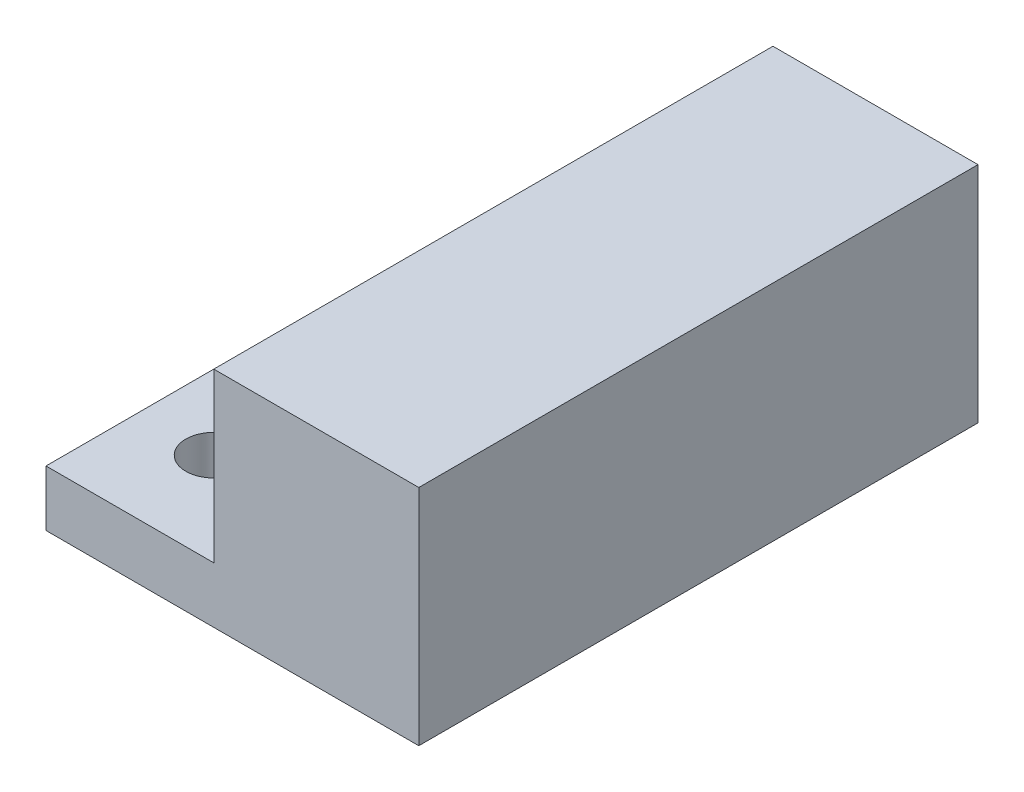
from build123d import *

# Parameters (mm, degrees)
SKETCH1_W           = 25.4
SKETCH1_H           = 38.1
SKETCH1_R           = 1.905
BOSS_EXTRUDE1_DEPTH = 3.81
BOSS_EXTRUDE2_DEPTH = 8.89
SKETCH3_W           = 13.97
SKETCH3_H           = 38.1
BOSS_EXTRUDE3_DEPTH = 2.54
CHAMFER1_SIZE       = 1.27


with BuildPart() as part:
    # Sketch1 → Boss-Extrude1 (new body)
    with BuildSketch(Plane(origin=(0, 0, 0), x_dir=(1, 0, 0), z_dir=(0, 1, 0))):
        with Locations((-7.62, -12.7)):
            Rectangle(SKETCH1_W, SKETCH1_H)
        Circle(SKETCH1_R, mode=Mode.SUBTRACT)
        with Locations((0, -25.4)):
            Circle(SKETCH1_R, mode=Mode.SUBTRACT)
    extrude(amount=BOSS_EXTRUDE1_DEPTH)

    # Sketch2 → Boss-Extrude2 (add)
    with BuildSketch(Plane(origin=(0, 3.81, 0), x_dir=(1, 0, 0), z_dir=(0, 1, 0))):
        Polygon((-20.32, 6.35), (-20.32, -31.75), (-6.35, -31.75), (-6.35, 6.35), (-8.89, 6.35), (-8.89, -29.21), (-17.78, -29.21), (-17.78, 6.35), align=None)
    extrude(amount=BOSS_EXTRUDE2_DEPTH)

    # Sketch3 → Boss-Extrude3 (add)
    with BuildSketch(Plane(origin=(0, 12.7, 0), x_dir=(1, 0, 0), z_dir=(0, 1, 0))):
        with Locations((-13.335, -12.7)):
            Rectangle(SKETCH3_W, SKETCH3_H)
    extrude(amount=BOSS_EXTRUDE3_DEPTH)

    # Chamfer1
    chamfer1_edges = [part.edges().sort_by_distance(p)[0] for p in [
        (-8.89, 12.7, 11.43),
        (-17.78, 12.7, 11.43),
    ]]
    chamfer(chamfer1_edges, length=CHAMFER1_SIZE)


with BuildPart() as body_2:
    # Mirror1: mirrored copy
    add(part.part.mirror(Plane(origin=(5.08, 3.81, -6.35), x_dir=(0, 0, 1), z_dir=(-1, 0, 0))))


solid = body_2.part
